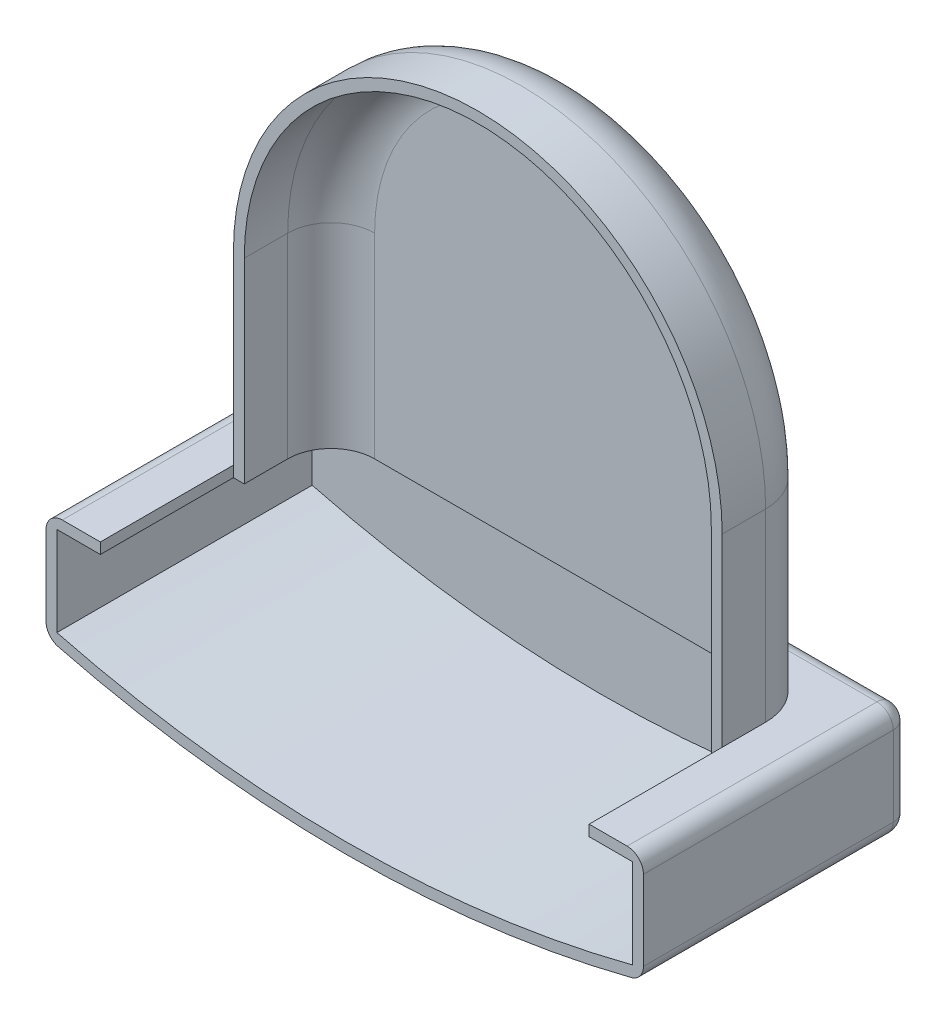
from build123d import *

# Parameters (mm, degrees)
BOSS_EXTRUDE1_DEPTH = 49
CUT_EXTRUDE1_DEPTH  = 39
SHELL2_START        = 2
SHELL2_DEPTH        = 8
BOSS_EXTRUDE8_START = -81
SKETCH5_W           = 90
SKETCH5_H           = 18
BOSS_EXTRUDE8_DEPTH = 81
CUT_EXTRUDE2_DEPTH  = 142.941008873
FILLET1_R           = 10
SHELL4_DEPTH        = 34
SHELL4_2_ANGLE      = 180
CUT_EXTRUDE6_START  = -3
CUT_EXTRUDE6_DEPTH  = 3
BOSS_EXTRUDE9_DEPTH = 2
SKETCH10_R          = 30
CUT_EXTRUDE4_DEPTH  = 1
FILLET2_R           = 2
FILLET3_R           = 3


with BuildPart() as part:
    # Sketch1 → Boss-Extrude1 (new body)
    with BuildSketch(Plane.XY):
        with BuildLine():
            Line((0, 0), (110, 0))
            Line((110, 0), (110, -20))
            ThreePointArc((110, -20), (55, -27.200969375), (0, -20))
            Line((0, -20), (0, 0))
        make_face()
    extrude(amount=BOSS_EXTRUDE1_DEPTH)

    # Sketch3 → Cut-Extrude1 (cut)
    with BuildSketch(Plane.XY.offset(49)):
        with BuildLine():
            Line((10, 3.939932323), (10, -2))
            Line((10, -2), (2, -2))
            Line((2, -2), (2, -18.45731355))
            ThreePointArc((2, -18.45731355), (55, -25.200969375), (108, -18.45731355))
            Line((108, -18.45731355), (108, -2))
            Line((108, -2), (100, -2))
            Line((100, -2), (100, 3.939932323))
            Line((100, 3.939932323), (10, 3.939932323))
        make_face()
    extrude(amount=-CUT_EXTRUDE1_DEPTH, mode=Mode.SUBTRACT)

    # Shell2: read off the stored shape, not the designer's step
    # Shell2 outline → Shell2 (cut)
    with BuildSketch(Plane.XY.offset(SHELL2_START)):
        with BuildLine():
            Line((108, -18.45731355), (108, -2))
            Line((108, -2), (2, -2))
            Line((2, -2), (2, -18.45731355))
            ThreePointArc((2, -18.45731355), (55, -25.200969375), (108, -18.45731355))
        make_face()
    extrude(amount=SHELL2_DEPTH, mode=Mode.SUBTRACT)

    # Sketch5 → Boss-Extrude8 (add)
    with BuildSketch(Plane(origin=(0, 79, 0), x_dir=(1, 0, 0), z_dir=(0, 1, 0)).offset(BOSS_EXTRUDE8_START)):
        with Locations((55, -15.5)):
            Rectangle(SKETCH5_W, SKETCH5_H)
    extrude(amount=BOSS_EXTRUDE8_DEPTH)

    # Sketch6 → Cut-Extrude2 (cut, through all)
    with BuildSketch(Plane(origin=(0, 0, 6.5), x_dir=(-1, 0, 0), z_dir=(0, 0, -1))):
        with BuildLine():
            Line((-100, 84.89286518), (-10, 84.89286518))
            Line((-10, 84.89286518), (-10, 34))
            ThreePointArc((-10, 34), (-55, 79), (-100, 34))
            Line((-100, 34), (-100, 84.89286518))
        make_face()
    extrude(amount=-CUT_EXTRUDE2_DEPTH, mode=Mode.SUBTRACT)

    # Fillet1
    fillet1_edges = [part.edges().sort_by_distance(p)[0] for p in [
        (100, 17, 6.5),
        (10, 17, 6.5),
        (55, 79, 6.5),
    ]]
    fillet(fillet1_edges, radius=FILLET1_R)

    # Shell4: read off the stored shape, not the designer's step
    # Shell4 outline → Shell4 (cut)
    with BuildSketch(Plane(origin=(0, 0, 0), x_dir=(1, 0, 0), z_dir=(0, 1, 0))):
        with BuildLine():
            ThreePointArc((20, -8.5), (14.343145751, -10.843145751), (12, -16.5))
            Line((12, -16.5), (12, -24.5))
            Line((12, -24.5), (98, -24.5))
            Line((98, -24.5), (98, -16.5))
            ThreePointArc((98, -16.5), (95.656854249, -10.843145751), (90, -8.5))
            Line((90, -8.5), (20, -8.5))
        make_face()
    extrude(amount=SHELL4_DEPTH, mode=Mode.SUBTRACT)

    # Shell4 2 outline → Shell4 2 (revolve, cut)
    with BuildSketch(Plane(origin=(55, 34, 0), x_dir=(1, 0, 0), z_dir=(0, -1, 0))):
        with BuildLine():
            Line((0, 24.5), (0, 8.5))
            Line((0, 8.5), (35, 8.5))
            ThreePointArc((35, 8.5), (40.656854249, 10.843145751), (43, 16.5))
            Line((43, 16.5), (43, 24.5))
            Line((43, 24.5), (0, 24.5))
        make_face()
    revolve(axis=Axis((55, 34, 0), (0, 0, 1)), revolution_arc=SHELL4_2_ANGLE, mode=Mode.SUBTRACT)

    # Sketch12 → Cut-Extrude6 (cut)
    with BuildSketch(Plane(origin=(0, 0, 0), x_dir=(1, 0, 0), z_dir=(0, 1, 0)).offset(CUT_EXTRUDE6_START)):
        with BuildLine():
            Line((90, -8.5), (20, -8.5))
            ThreePointArc((20, -8.5), (14.343145751, -10.843145751), (12, -16.5))
            Line((12, -16.5), (12, -24.5))
            Line((12, -24.5), (98, -24.5))
            Line((98, -24.5), (98, -16.5))
            ThreePointArc((98, -16.5), (95.656854249, -10.843145751), (90, -8.5))
        make_face()
    extrude(amount=CUT_EXTRUDE6_DEPTH, mode=Mode.SUBTRACT)

    # Sketch9 → Boss-Extrude9 (add)
    with BuildSketch(Plane(origin=(0, 0, 6.5), x_dir=(-1, 0, 0), z_dir=(0, 0, -1))):
        with BuildLine():
            Line((-90, 0), (-20, 0))
            Line((-20, 0), (-20, 34))
            ThreePointArc((-20, 34), (-55, 69), (-90, 34))
            Line((-90, 34), (-90, 0))
        make_face()
    extrude(amount=BOSS_EXTRUDE9_DEPTH)

    # Sketch10 → Cut-Extrude4 (cut)
    with BuildSketch(Plane(origin=(0, 0, 4.5), x_dir=(-1, 0, 0), z_dir=(0, 0, -1))):
        with Locations((-55, 34)):
            Circle(SKETCH10_R)
    extrude(amount=-CUT_EXTRUDE4_DEPTH, mode=Mode.SUBTRACT)

    # Fillet2
    fillet2_edges = [part.edges().sort_by_distance(p)[0] for p in [
        (20, 17, 4.5),
        (55, 69, 4.5),
        (90, 17, 4.5),
    ]]
    fillet(fillet2_edges, radius=FILLET2_R - 0.0001)  # a hair under: the kernel refuses the full size

    # Fillet3
    fillet3_edges = [part.edges().sort_by_distance(p)[0] for p in [
        (55, 0, 0),
        (110, -10, 0),
        (55, -27.200969375, 0),
        (0, -10, 0),
        (0, 0, 24.5),
        (110, 0, 24.5),
        (110, -20, 24.5),
        (0, -20, 24.5),
    ]]
    fillet(fillet3_edges, radius=FILLET3_R)


solid = part.part
